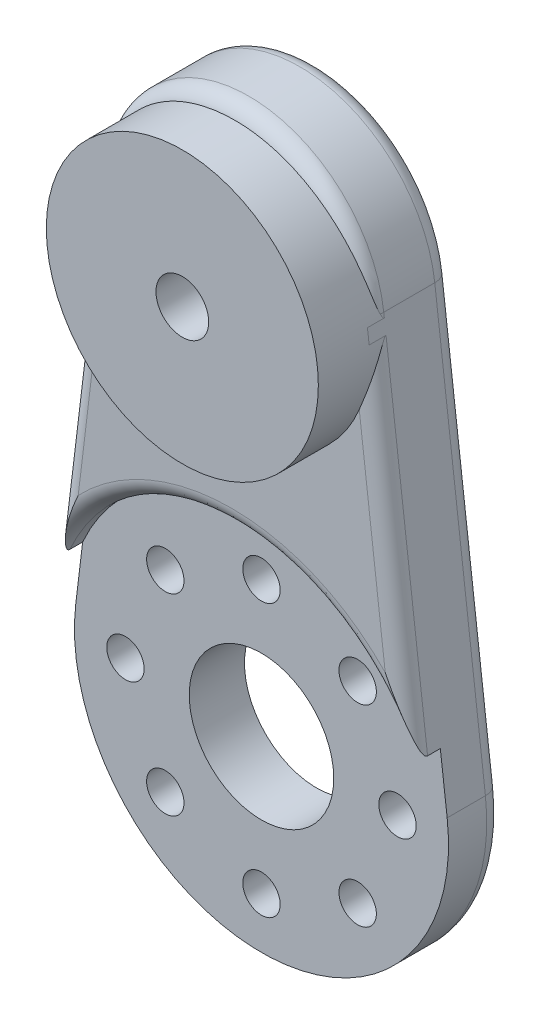
from build123d import *

# Parameters (mm, degrees)
SKETCH1_R           = 1.55
SKETCH1_R_2         = 4.25
SKETCH1_R_3         = 1.1
BOSS_EXTRUDE1_DEPTH = 5
SKETCH2_R           = 11.5
CUT_EXTRUDE1_DEPTH  = 1.75
CUT_EXTRUDE2_DEPTH  = 3
SKETCH5_R           = 8
SKETCH5_R_2         = 1.55
BOSS_EXTRUDE2_DEPTH = 3
FILLET1_R           = 1


with BuildPart() as part:
    # Sketch1 → Boss-Extrude1 (new body)
    with BuildSketch(Plane.XY):
        with BuildLine():
            Line((-22.926334266, 5.526262294), (-25.904655941, -19.113737706))
            ThreePointArc((-25.904655941, -19.113737706), (-14.984143133, -31.433737706), (-4.063630324, -19.113737706))
            Line((-4.063630324, -19.113737706), (-7.041951999, 5.526262294))
            ThreePointArc((-7.041951999, 5.526262294), (-14.984143133, 12.566262294), (-22.926334266, 5.526262294))
        make_face()
        with Locations((-14.984143133, 4.566262294)):
            Circle(SKETCH1_R, mode=Mode.SUBTRACT)
        with Locations((-14.984143133, -20.433737706)):
            Circle(SKETCH1_R_2, mode=Mode.SUBTRACT)
        with Locations((-6.984143133, -20.433737706)):
            Circle(SKETCH1_R_3, mode=Mode.SUBTRACT)
        with Locations((-9.327288883, -26.090591955)):
            Circle(SKETCH1_R_3, mode=Mode.SUBTRACT)
        with Locations((-14.984143133, -28.433737706)):
            Circle(SKETCH1_R_3, mode=Mode.SUBTRACT)
        with Locations((-20.640997382, -26.090591955)):
            Circle(SKETCH1_R_3, mode=Mode.SUBTRACT)
        with Locations((-22.984143133, -20.433737706)):
            Circle(SKETCH1_R_3, mode=Mode.SUBTRACT)
        with Locations((-20.640997382, -14.776883456)):
            Circle(SKETCH1_R_3, mode=Mode.SUBTRACT)
        with Locations((-14.984143133, -12.433737706)):
            Circle(SKETCH1_R_3, mode=Mode.SUBTRACT)
        with Locations((-9.327288883, -14.776883456)):
            Circle(SKETCH1_R_3, mode=Mode.SUBTRACT)
    extrude(amount=BOSS_EXTRUDE1_DEPTH)

    # Sketch2 → Cut-Extrude1 (cut)
    with BuildSketch(Plane.XY.offset(5)):
        with Locations((-14.984143133, -20.433737706)):
            Circle(SKETCH2_R)
    extrude(amount=-CUT_EXTRUDE1_DEPTH, mode=Mode.SUBTRACT)

    # Sketch3 → Cut-Extrude2 (cut)
    with BuildSketch(Plane.XY):
        Polygon((-15.415032752, 7.712318154), (-17.924152238, 5.766128868), (-17.493262619, 2.620073008), (-14.553253513, 1.420206435), (-12.044134027, 3.366395721), (-12.475023646, 6.512451581), align=None)
    extrude(amount=CUT_EXTRUDE2_DEPTH, mode=Mode.SUBTRACT)

    # Sketch5 → Boss-Extrude2 (add)
    with BuildSketch(Plane.XY.offset(5)):
        with Locations(Location((-14.88966218, 3.876428191, 0), (0, 0, 9.899538967))):
            Circle(SKETCH5_R)
        with Locations(Location((-14.88966218, 3.876428191, 0), (0, 0, 174.819185621))):
            Circle(SKETCH5_R_2, mode=Mode.SUBTRACT)
    extrude(amount=BOSS_EXTRUDE2_DEPTH)

    # Fillet1
    # the kernel refuses this fillet: 1 mm, written as the material it takes off along each edge
    with BuildSketch(Plane(origin=(-4.063630324, -19.113737706, 0), x_dir=(-0.9927738916792687, -0.11999999999999997, 0), z_dir=(-0.11999999999999997, 0.9927738916792685, 0))) as fillet1_piece_1:
        with BuildLine():
            CenterArc((FILLET1_R, FILLET1_R), FILLET1_R, 180, 90)
            Line((0, FILLET1_R), (0, 0))
            Line((0, 0), (FILLET1_R, 0))
        make_face()
    extrude(amount=24.819347292, mode=Mode.SUBTRACT)
    with BuildSketch(Plane(origin=(-14.984143133, -20.433737706, 0), x_dir=(-0.9927738916792687, 0.1199999999999997, 0), z_dir=(0.1199999999999997, 0.9927738916792687, 0))) as fillet1_piece_2:
        with BuildLine():
            CenterArc((11 - FILLET1_R, FILLET1_R), FILLET1_R, 270, 90)
            Line((11, FILLET1_R), (11, 0))
            Line((11, 0), (11 - FILLET1_R, 0))
        make_face()
    revolve(axis=Axis((-14.984143133, -20.433737706, 0), (0, 0, 1)), revolution_arc=193.784205159, mode=Mode.SUBTRACT)
    with BuildSketch(Plane(origin=(-14.984143133, -20.433737706, 5), x_dir=(0.980329402644487, 0.19736834171341458, 0), z_dir=(0.19736834171341458, -0.980329402644487, 0))) as fillet1_piece_3:
        with BuildLine():
            CenterArc((11.5 + FILLET1_R, -FILLET1_R), FILLET1_R, 90, 90)
            Line((11.5 + FILLET1_R, 0), (11.5, 0))
            Line((11.5, 0), (11.5, -FILLET1_R))
        make_face()
    revolve(axis=Axis((-14.984143133, -20.433737706, 5), (0, 0, 1)), revolution_arc=157.233782309, mode=Mode.SUBTRACT)
    with BuildSketch(Plane(origin=(-14.984143133, 4.566262294, 0), x_dir=(0.9927738916792685, 0.12000000000000052, 0), z_dir=(0.12000000000000052, -0.9927738916792685, 0))) as fillet1_piece_4:
        with BuildLine():
            CenterArc((8 - FILLET1_R, FILLET1_R), FILLET1_R, 270, 90)
            Line((8, FILLET1_R), (8, 0))
            Line((8, 0), (8 - FILLET1_R, 0))
        make_face()
    revolve(axis=Axis((-14.984143133, 4.566262294, 0), (0, 0, 1)), revolution_arc=166.215794841, mode=Mode.SUBTRACT)
    with BuildSketch(Plane(origin=(-22.926334266, 5.526262294, 0), x_dir=(0, 0, 1), z_dir=(-0.11999999999999994, -0.9927738916792685, 0))) as fillet1_piece_5:
        with BuildLine():
            CenterArc((FILLET1_R, -FILLET1_R), FILLET1_R, 90, 90)
            Line((0, -FILLET1_R), (0, 0))
            Line((0, 0), (FILLET1_R, 0))
        make_face()
    extrude(amount=24.819347292, mode=Mode.SUBTRACT)
    with BuildSketch(Plane(origin=(-4.16612256, -18.265807573, 5), x_dir=(-0.9927738916792687, -0.11999999999999998, 0), z_dir=(-0.11999999999999997, 0.9927738916792685, 0))) as fillet1_piece_6_section:
        with BuildLine():
            CenterArc((FILLET1_R, -FILLET1_R), FILLET1_R, 90, 90)
            Line((0, -FILLET1_R), (0, 0))
            Line((0, 0), (FILLET1_R, 0))
        make_face()
    fillet1_piece_6 = extrude(amount=25.349333785, mode=Mode.PRIVATE)
    fillet1_piece_6 = fillet1_piece_6 - Plane(origin=(-14.88966218, 3.876428191, 4.768901456), x_dir=(0.9851107095579202, 0.17192117354849282, 0), z_dir=(0, 0, -1)) * Cylinder(8, 55, mode=Mode.PRIVATE)
    add(fillet1_piece_6, mode=Mode.SUBTRACT)
    with BuildSketch(Plane(origin=(-6.708776504, 2.76986285, 5), x_dir=(-0.9927738916792687, -0.11999999999999998, 0), z_dir=(-0.11999999999999997, 0.9927738916792685, 0))) as fillet1_piece_7_section:
        with BuildLine():
            CenterArc((FILLET1_R, -FILLET1_R), FILLET1_R, 90, 90)
            Line((0, -FILLET1_R), (0, 0))
            Line((0, 0), (FILLET1_R, 0))
        make_face()
    fillet1_piece_7 = extrude(amount=2.776462463, mode=Mode.PRIVATE)
    fillet1_piece_7 = fillet1_piece_7 - Plane(origin=(-14.88966218, 3.876428191, 4.554846091), x_dir=(0.9851107095579202, 0.17192117354849282, 0), z_dir=(0, 0, -1)) * Cylinder(8, 10, mode=Mode.PRIVATE)
    add(fillet1_piece_7, mode=Mode.SUBTRACT)
    with BuildSketch(Plane(origin=(-22.926334266, 5.526262294, 5), x_dir=(0, 0, -1), z_dir=(-0.11999999999999994, -0.9927738916792685, 0))) as fillet1_piece_8_section:
        with BuildLine():
            CenterArc((FILLET1_R, FILLET1_R), FILLET1_R, 180, 90)
            Line((0, FILLET1_R), (0, 0))
            Line((0, 0), (FILLET1_R, 0))
        make_face()
    fillet1_piece_8 = extrude(amount=23.965245326, mode=Mode.PRIVATE)
    fillet1_piece_8 = fillet1_piece_8 - Plane(origin=(-14.88966218, 3.876428191, 4.768639771), x_dir=(0.9851107095579202, 0.17192117354849282, 0), z_dir=(0, 0, -1)) * Cylinder(8, 52, mode=Mode.PRIVATE)
    add(fillet1_piece_8, mode=Mode.SUBTRACT)
    with BuildSketch(Plane(origin=(-14.984143133, 4.566262294, 5), x_dir=(0.9927738916792685, 0.12000000000000052, 0), z_dir=(0.12000000000000052, -0.9927738916792685, 0))) as fillet1_piece_9_section:
        with BuildLine():
            CenterArc((8 - FILLET1_R, -FILLET1_R), FILLET1_R, 0, 90)
            Line((8, -FILLET1_R), (8, 0))
            Line((8, 0), (8 - FILLET1_R, 0))
        make_face()
    fillet1_piece_9 = revolve(axis=Axis((-14.984143133, 4.566262294, 5), (0, 0, 1)), revolution_arc=166.215794841, mode=Mode.PRIVATE)
    fillet1_piece_9 = fillet1_piece_9 - Plane(origin=(-14.88966218, 3.876428191, 4.59944893), x_dir=(0.9851107095579202, 0.17192117354849282, 0), z_dir=(0, 0, -1)) * Cylinder(8, 33, mode=Mode.PRIVATE)
    add(fillet1_piece_9, mode=Mode.SUBTRACT)


solid = part.part
